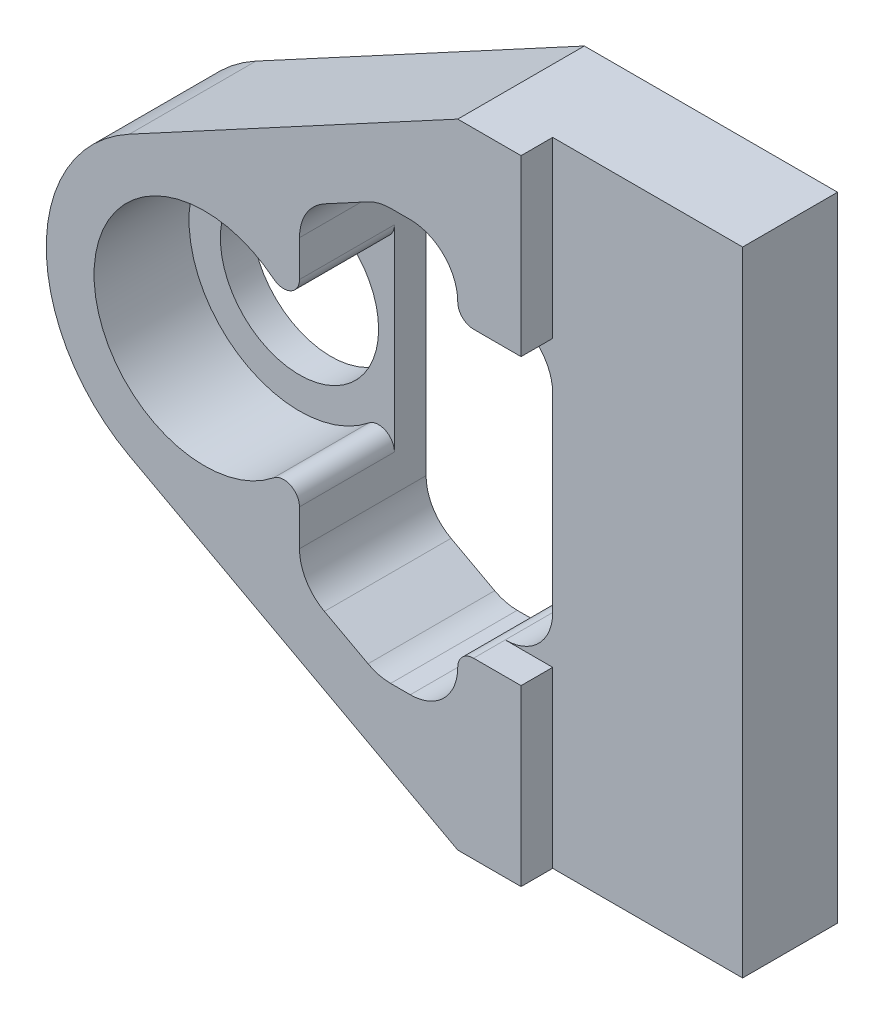
from build123d import *

# Parameters (mm, degrees)
SKETCH1_R           = 2.5
BOSS_EXTRUDE1_DEPTH = 4
SKETCH4_R           = 3.49
CUT_EXTRUDE1_DEPTH  = 3
SKETCH5_W           = 6
SKETCH5_H           = 20
CUT_EXTRUDE2_DEPTH  = 1
CUT_EXTRUDE3_REACH  = 21.287
FILLET1_R           = 0.5
FILLET2_R           = 1.5
FILLET3_R           = 0.5


with BuildPart() as part:
    # Sketch1 → Boss-Extrude1 (new body)
    with BuildSketch(Plane.XY):
        with BuildLine():
            Line((-2.374946989, 4.399957591), (8, 10))
            Line((8, 10), (16, 10))
            Line((16, 10), (16, -10))
            Line((16, -10), (8, -10))
            Line((8, -10), (-2.374946989, -4.399957591))
            ThreePointArc((-2.374946989, -4.399957591), (-5, 0), (-2.374946989, 4.399957591))
        make_face()
        Circle(SKETCH1_R, mode=Mode.SUBTRACT)
    extrude(amount=BOSS_EXTRUDE1_DEPTH)

    # Sketch4 → Cut-Extrude1 (cut)
    with BuildSketch(Plane.XY.offset(4)):
        Circle(SKETCH4_R)
    extrude(amount=-CUT_EXTRUDE1_DEPTH, mode=Mode.SUBTRACT)

    # Sketch5 → Cut-Extrude2 (cut)
    with BuildSketch(Plane.XY.offset(4)):
        with Locations((13, 0)):
            Rectangle(SKETCH5_W, SKETCH5_H)
    extrude(amount=-CUT_EXTRUDE2_DEPTH, mode=Mode.SUBTRACT)

    # Sketch6 → Cut-Extrude3 (cut, up to next)
    with BuildSketch(Plane.XY.offset(4), mode=Mode.PRIVATE) as cut_extrude3_sk1:
        Polygon((3, 5.150585296), (5.5, 6.5), (8, 6.5), (8, 4.5), (10, 4.5), (10, -4.5), (8, -4.5), (8, -6.5), (5.5, -6.5), (3, -5.150585296), align=None)
    cut_extrude3_tool1 = extrude(cut_extrude3_sk1.sketch, amount=-CUT_EXTRUDE3_REACH, mode=Mode.PRIVATE) & part.part
    add(cut_extrude3_tool1.solids().sort_by_distance((6.361806, 0, 4))[0], mode=Mode.SUBTRACT)

    # Fillet1
    fillet1_edges = [part.edges().sort_by_distance(p)[0] for p in [
        (3, -1.783283488, 2.5),
        (3, 1.783283488, 2.5),
    ]]
    fillet(fillet1_edges, radius=FILLET1_R)

    # Fillet2
    fillet2_edges = [part.edges().sort_by_distance(p)[0] for p in [
        (10, 4.5, 1.5),
        (3, -5.150585296, 2),
        (3, 5.150585296, 2),
        (5.5, 6.5, 2),
        (8, 6.5, 2),
        (10, -4.5, 1.5),
        (8, -6.5, 2),
        (5.5, -6.5, 2),
    ]]
    fillet(fillet2_edges, radius=FILLET2_R)

    # Fillet3
    fillet3_edges = [part.edges().sort_by_distance(p)[0] for p in [
        (8, -4.5, 2),
        (8, 4.5, 2),
    ]]
    fillet(fillet3_edges, radius=FILLET3_R - 0.0001)  # a hair under: the kernel refuses the full size


solid = part.part
